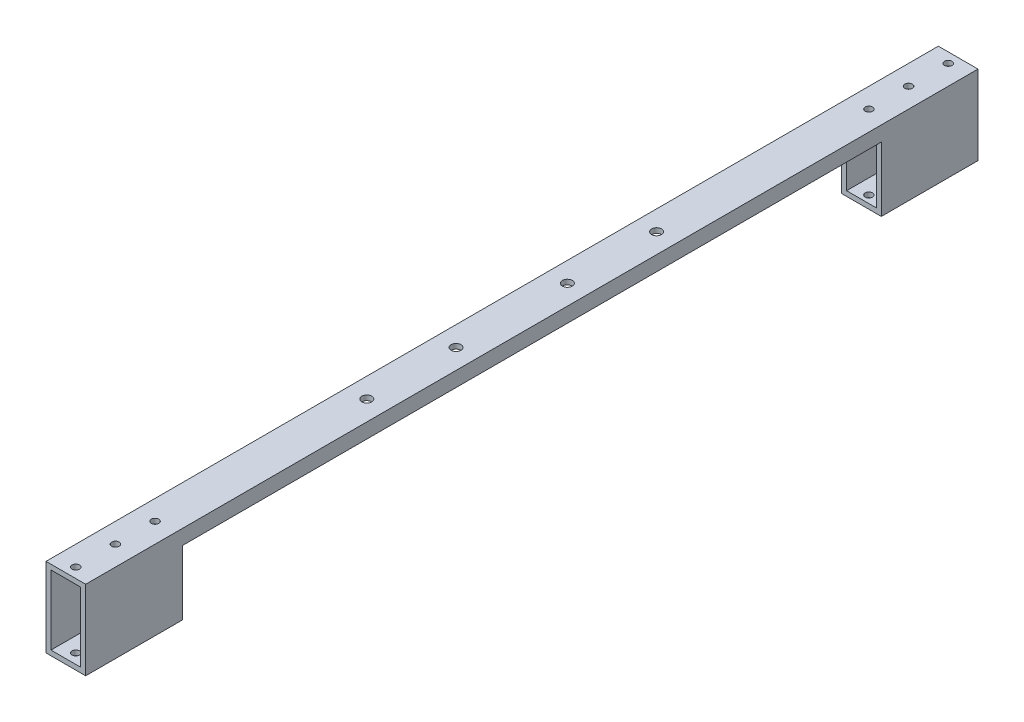
from build123d import *

# Parameters (mm, degrees)
SKETCH1_W                      = 25.4
SKETCH1_H                      = 50.8
SKETCH1_W_2                    = 19.05
SKETCH1_H_2                    = 44.45
EXTRUDE_THIN1_DEPTH            = 571.5
F_3_16_0_1875_DIAMETER_HOLE1_D = 4.7625
F_1_4_0_25_DIAMETER_HOLE1_D    = 6.35
SKETCH10_W                     = 447.6496
SKETCH10_H                     = 41.275
CUT_EXTRUDE1_DEPTH             = 573.627776134


with BuildPart() as part:
    # Sketch1 → Extrude-Thin1 (new body)
    with BuildSketch(Plane.XY):
        Rectangle(SKETCH1_W, SKETCH1_H)
        Rectangle(SKETCH1_W_2, SKETCH1_H_2, mode=Mode.SUBTRACT)
    extrude(amount=EXTRUDE_THIN1_DEPTH)

    # 3/16 (0.1875) Diameter Hole1 (through all)
    with Locations(Plane(origin=(0, 25.4, 565.15), x_dir=(0, 0, 1), z_dir=(0, 1, 0))):
        with Locations((0, 0), (-558.8, 0), (-533.4, 0), (-508, 0), (-25.4, 0), (-50.8, 0)):
            Hole(F_3_16_0_1875_DIAMETER_HOLE1_D / 2)

    # 1/4 (0.25) Diameter Hole1 (through all)
    with Locations(Plane(origin=(0, 25.4, 0), x_dir=(1, 0, 0), z_dir=(0, 1, 0))):
        with Locations((0, -321.564), (0, -378.714), (0, -193.167), (0, -250.317)):
            Hole(F_1_4_0_25_DIAMETER_HOLE1_D / 2)

    # Sketch10 → Cut-Extrude1 (cut, through all)
    with BuildSketch(Plane(origin=(12.7, 0, 0), x_dir=(0, 0, -1), z_dir=(1, 0, 0))):
        with Locations((-285.75, -4.7625)):
            Rectangle(SKETCH10_W, SKETCH10_H)
    extrude(amount=-CUT_EXTRUDE1_DEPTH, mode=Mode.SUBTRACT)


solid = part.part
